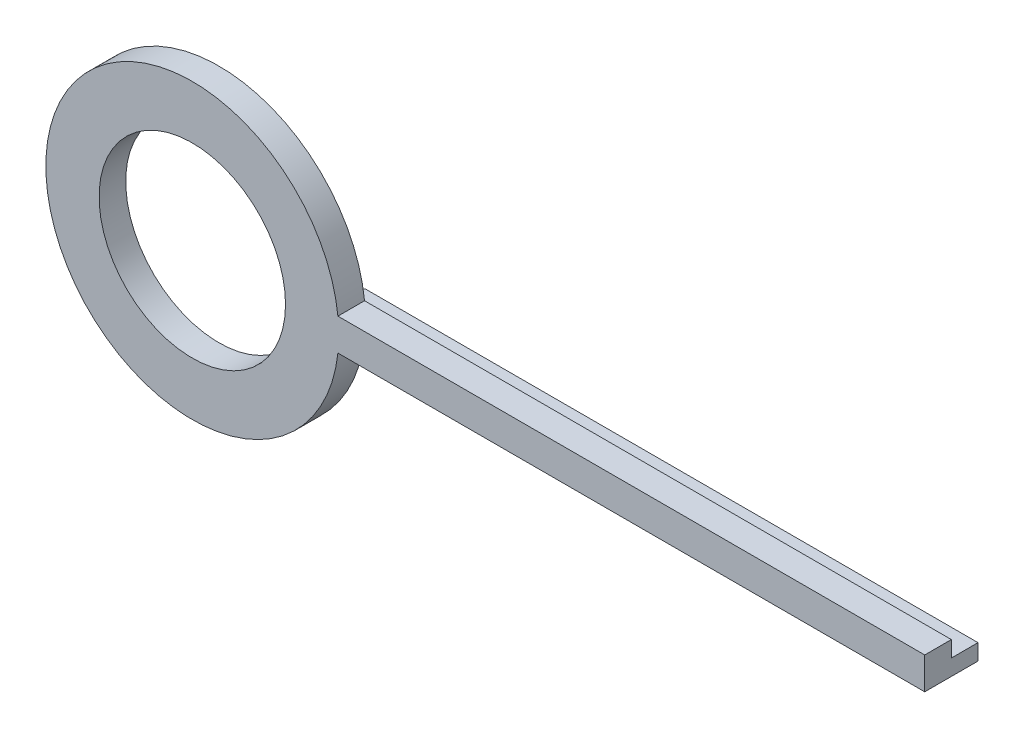
from build123d import *

# Parameters (mm, degrees)
SKETCH1_R           = 27.5
SKETCH1_R_2         = 17.5
BOSS_EXTRUDE1_DEPTH = 5
SKETCH2_W           = 120
SKETCH2_H           = 6
BOSS_EXTRUDE2_DEPTH = 10
SKETCH3_W           = 5
SKETCH3_H           = 3
CUT_EXTRUDE1_DEPTH  = 140
CHAMFER1_SIZE       = 5


with BuildPart() as part:
    # Sketch1 → Boss-Extrude1 (new body)
    with BuildSketch(Plane.XY):
        Circle(SKETCH1_R)
        Circle(SKETCH1_R_2, mode=Mode.SUBTRACT)
    extrude(amount=BOSS_EXTRUDE1_DEPTH)

    # Sketch2 → Boss-Extrude2 (add)
    with BuildSketch(Plane.XY.offset(5)):
        with Locations((77.5, 0)):
            Rectangle(SKETCH2_W, SKETCH2_H)
    extrude(amount=-BOSS_EXTRUDE2_DEPTH)

    # Sketch3 → Cut-Extrude1 (cut)
    with BuildSketch(Plane.ZY.offset(-17.5)):
        with Locations((-2.5, 1.5)):
            Rectangle(SKETCH3_W, SKETCH3_H)
    extrude(amount=-CUT_EXTRUDE1_DEPTH, mode=Mode.SUBTRACT)

    # Chamfer1
    chamfer1_edges = [part.edges().sort_by_distance(p)[0] for p in [
        (17.5, -1.5, -5),
    ]]
    chamfer(chamfer1_edges, length=CHAMFER1_SIZE - 0.0001)  # a hair under: the kernel refuses the full size


solid = part.part
